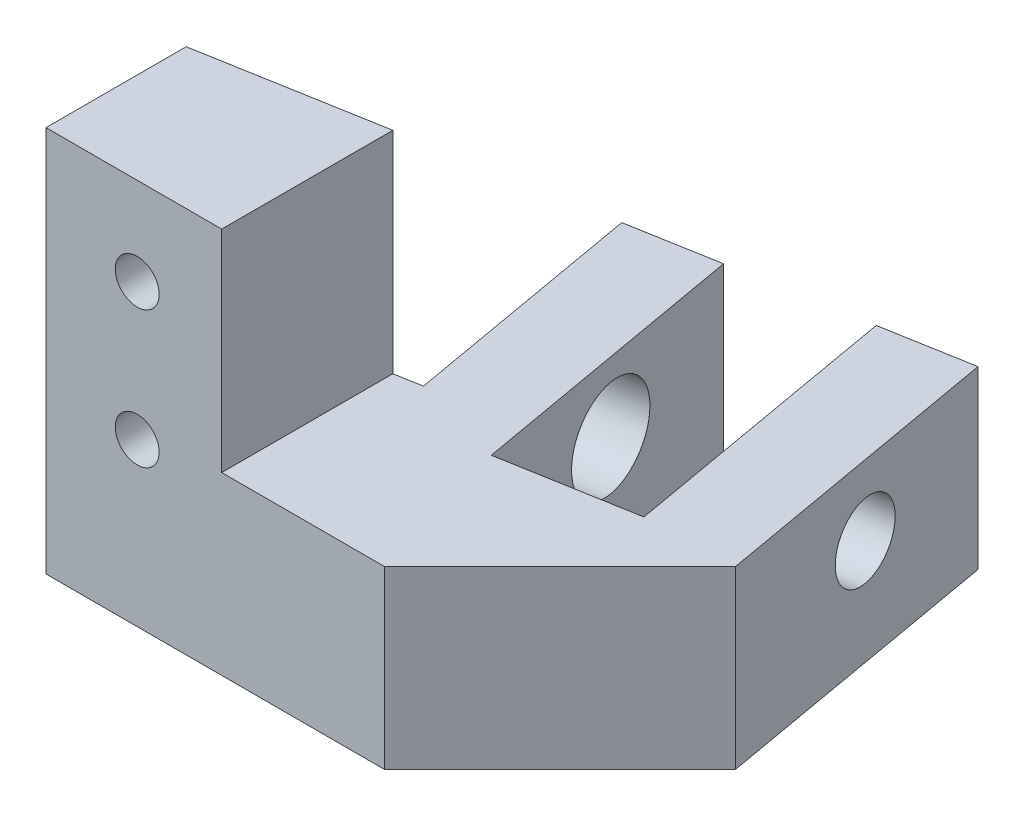
from build123d import *

# Parameters (mm, degrees)
BOSS_EXTRU_1_DEPTH      = 10
BOSS_EXTRU_2_DEPTH      = 10
ENL_V_MAT_EXTRU_1_REACH = 37.775
ENL_V_MAT_EXTRU_2_REACH = 34.103
ESQUISSE4_R             = 2.75
ENL_V_MAT_EXTRU_3_REACH = 37.12
ESQUISSE5_R             = 2.1
CHANFREIN1_SIZE         = 10
ENL_V_MAT_EXTRU_4_REACH = 42.247
ENL_V_MAT_EXTRU_5_REACH = 47.329
ESQUISSE7_R             = 1.25


with BuildPart() as part:
    # Esquisse1 → Boss.-Extru.1 (new body)
    with BuildSketch(Plane.XY):
        Polygon((0, 0), (29.25, 0), (29.25, 10), (10, 10), (10, 22), (0, 22), align=None)
    extrude(amount=BOSS_EXTRU_1_DEPTH)

    # Esquisse2 → Boss.-Extru.2 (add)
    with BuildSketch(Plane(origin=(0, 10, 0), x_dir=(1, 0, 0), z_dir=(0, 1, 0))):
        Polygon((29.25, 0), (26.29798098, 16.741731801), (21.373942215, 15.873490913), (24.172866941, 0), align=None)
        Polygon((16.557167351, 0), (13.987884067, 14.57112958), (9.063845302, 13.702888692), (11.480034292, 0), align=None)
    extrude(amount=-BOSS_EXTRU_2_DEPTH)

    # Esquisse3 → Enlèv. mat.-Extru.1 (cut, up to next)
    with BuildSketch(Plane(origin=(0, 10, 0), x_dir=(1, 0, 0), z_dir=(0, 1, 0)), mode=Mode.PRIVATE) as enl_v_mat_extru_1_sk1:
        Polygon((16.557167351, 0), (16.817639618, -1.47721163), (24.203697766, -0.174850297), (24.172866941, 0), align=None)
    enl_v_mat_extru_1_tool1 = extrude(enl_v_mat_extru_1_sk1.sketch, amount=-ENL_V_MAT_EXTRU_1_REACH, mode=Mode.PRIVATE) & part.part
    add(enl_v_mat_extru_1_tool1.solids().sort_by_distance((19.452321, 10, 0.498572))[0], mode=Mode.SUBTRACT)

    # Esquisse4 → Enlèv. mat.-Extru.2 (cut, up to next)
    with BuildSketch(Plane(origin=(11.133868901, 0, -1.963201487), x_dir=(0.1736481776669311, 0, 0.9848077530122079), z_dir=(-0.9848077530122079, 0, 0.1736481776669311)), mode=Mode.PRIVATE) as enl_v_mat_extru_2_sk1:
        with Locations((-4.006512966, 6)):
            Circle(ESQUISSE4_R)
    enl_v_mat_extru_2_tool1 = extrude(enl_v_mat_extru_2_sk1.sketch, amount=-ENL_V_MAT_EXTRU_2_REACH, mode=Mode.PRIVATE) & part.part
    add(enl_v_mat_extru_2_tool1.solids().sort_by_distance((10.438145, 6, -5.908847))[0], mode=Mode.SUBTRACT)

    # Esquisse5 → Enlèv. mat.-Extru.3 (cut, up to next)
    with BuildSketch(Plane(origin=(23.443965814, 0, -4.133803708), x_dir=(0.1736481776669306, 0, 0.9848077530122081), z_dir=(-0.9848077530122081, 0, 0.1736481776669306)), mode=Mode.PRIVATE) as enl_v_mat_extru_3_sk1:
        with Locations((-4.006512966, 6)):
            Circle(ESQUISSE5_R)
    enl_v_mat_extru_3_tool1 = extrude(enl_v_mat_extru_3_sk1.sketch, amount=-ENL_V_MAT_EXTRU_3_REACH, mode=Mode.PRIVATE) & part.part
    add(enl_v_mat_extru_3_tool1.solids().sort_by_distance((22.748242, 6, -8.079449))[0], mode=Mode.SUBTRACT)

    # Chanfrein1
    chanfrein1_edges = [part.edges().sort_by_distance(p)[0] for p in [
        (29.25, 5, 10),
    ]]
    chamfer(chanfrein1_edges, length=CHANFREIN1_SIZE - 0.0001)  # a hair under: the kernel refuses the full size

    # Esquisse6 → Enlèv. mat.-Extru.4 (cut, up to next)
    with BuildSketch(Plane(origin=(0, 22, 0), x_dir=(1, 0, 0), z_dir=(0, 1, 0)), mode=Mode.PRIVATE) as enl_v_mat_extru_4_sk1:
        Polygon((0, 0), (11.480034292, 0), (0, -2.024239785), align=None)
    enl_v_mat_extru_4_tool1 = extrude(enl_v_mat_extru_4_sk1.sketch, amount=-ENL_V_MAT_EXTRU_4_REACH, mode=Mode.PRIVATE) & part.part
    add(enl_v_mat_extru_4_tool1.solids().sort_by_distance((3.826678, 22, 0.674747))[0], mode=Mode.SUBTRACT)

    # Enlèv. mat.-Extru.5: up to this plane
    enl_v_mat_extru_5_end = Plane(origin=(11.480034292, -0.001, 0), z_dir=(0.1736481776669316, 0, 0.9848077530122079))
    # Esquisse7 → Enlèv. mat.-Extru.5 (cut, up to the surface)
    with BuildSketch(Plane.XY.offset(10), mode=Mode.PRIVATE) as enl_v_mat_extru_5_sk1:
        with Locations((5.19, 17)):
            Circle(ESQUISSE7_R)
    enl_v_mat_extru_5_tool1 = split(extrude(enl_v_mat_extru_5_sk1.sketch, amount=-ENL_V_MAT_EXTRU_5_REACH, mode=Mode.PRIVATE), bisect_by=enl_v_mat_extru_5_end, keep=Keep.BOTH, mode=Mode.PRIVATE)
    add(enl_v_mat_extru_5_tool1.solids().sort_by_distance((5.19, 17, 10))[0], mode=Mode.SUBTRACT)
    # Esquisse7 → Enlèv. mat.-Extru.5 (cut, up to the surface)
    with BuildSketch(Plane.XY.offset(10), mode=Mode.PRIVATE) as enl_v_mat_extru_5_sk2:
        with Locations((5.19, 9.22)):
            Circle(ESQUISSE7_R)
    enl_v_mat_extru_5_tool2 = split(extrude(enl_v_mat_extru_5_sk2.sketch, amount=-ENL_V_MAT_EXTRU_5_REACH, mode=Mode.PRIVATE), bisect_by=enl_v_mat_extru_5_end, keep=Keep.BOTH, mode=Mode.PRIVATE)
    add(enl_v_mat_extru_5_tool2.solids().sort_by_distance((5.19, 9.22, 10))[0], mode=Mode.SUBTRACT)


solid = part.part
